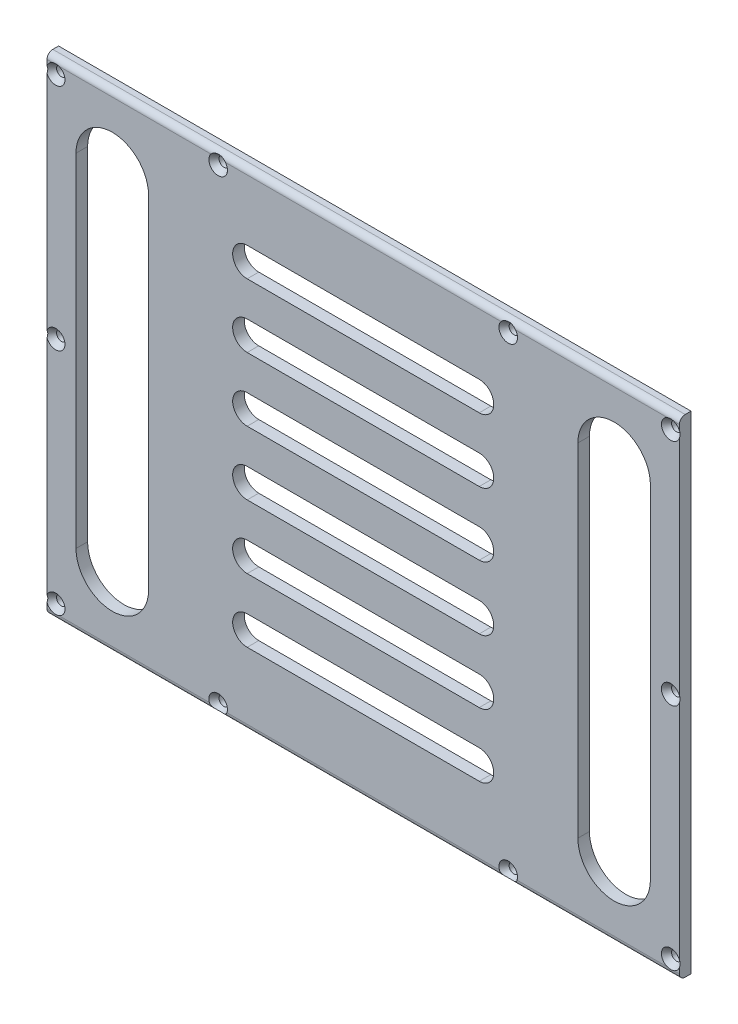
from build123d import *

# Parameters (mm, degrees)
SKETCH1_W           = 168
SKETCH1_H           = 218
SKETCH1_R           = 1.7
BOSS_EXTRUDE2_DEPTH = 4
CHAMFER1_SIZE       = 2
CHAMFER1_SIZE_2     = 1.5
FILLET1_R           = 2


with BuildPart() as part:
    # Sketch1 → Boss-Extrude2 (new body)
    with BuildSketch(Plane(origin=(0, 0, 0), x_dir=(0, 1, 0), z_dir=(0, 0, 1))):
        with Locations((84, 109)):
            Rectangle(SKETCH1_W, SKETCH1_H)
        with Locations(Location((5, 3, 0), (0, 0, 270))):
            Circle(SKETCH1_R, mode=Mode.SUBTRACT)
        with Locations(Location((5, 215, 0), (0, 0, 270))):
            Circle(SKETCH1_R, mode=Mode.SUBTRACT)
        with Locations(Location((163, 215, 0), (0, 0, 270))):
            Circle(SKETCH1_R, mode=Mode.SUBTRACT)
        with Locations(Location((163, 3, 0), (0, 0, 270))):
            Circle(SKETCH1_R, mode=Mode.SUBTRACT)
        with Locations(Location((84, 215, 0), (0, 0, 270))):
            Circle(SKETCH1_R, mode=Mode.SUBTRACT)
        with Locations(Location((84, 3, 0), (0, 0, 270))):
            Circle(SKETCH1_R, mode=Mode.SUBTRACT)
        with Locations(Location((3, 59, 0), (0, 0, 270))):
            Circle(SKETCH1_R, mode=Mode.SUBTRACT)
        with Locations(Location((164, 59, 0), (0, 0, 270))):
            Circle(SKETCH1_R, mode=Mode.SUBTRACT)
        with Locations(Location((164, 159, 0), (0, 0, 270))):
            Circle(SKETCH1_R, mode=Mode.SUBTRACT)
        with Locations(Location((3, 159, 0), (0, 0, 270))):
            Circle(SKETCH1_R, mode=Mode.SUBTRACT)
        with BuildLine():
            Line((35, 149), (35, 69))
            ThreePointArc((35, 69), (30, 64), (25, 69))
            Line((25, 69), (25, 149))
            ThreePointArc((25, 149), (30, 154), (35, 149))
        make_face(mode=Mode.SUBTRACT)
        with BuildLine():
            Line((57, 149), (57, 69))
            ThreePointArc((57, 69), (52, 64), (47, 69))
            Line((47, 69), (47, 149))
            ThreePointArc((47, 149), (52, 154), (57, 149))
        make_face(mode=Mode.SUBTRACT)
        with BuildLine():
            Line((79, 149), (79, 69))
            ThreePointArc((79, 69), (74, 64), (69, 69))
            Line((69, 69), (69, 149))
            ThreePointArc((69, 149), (74, 154), (79, 149))
        make_face(mode=Mode.SUBTRACT)
        with BuildLine():
            Line((101, 149), (101, 69))
            ThreePointArc((101, 69), (96, 64), (91, 69))
            Line((91, 69), (91, 149))
            ThreePointArc((91, 149), (96, 154), (101, 149))
        make_face(mode=Mode.SUBTRACT)
        with BuildLine():
            Line((123, 149), (123, 69))
            ThreePointArc((123, 69), (118, 64), (113, 69))
            Line((113, 69), (113, 149))
            ThreePointArc((113, 149), (118, 154), (123, 149))
        make_face(mode=Mode.SUBTRACT)
        with BuildLine():
            Line((145, 149), (145, 69))
            ThreePointArc((145, 69), (140, 64), (135, 69))
            Line((135, 69), (135, 149))
            ThreePointArc((135, 149), (140, 154), (145, 149))
        make_face(mode=Mode.SUBTRACT)
        with BuildLine():
            Line((25, 208), (143, 208))
            ThreePointArc((143, 208), (155.5, 195.5), (143, 183))
            Line((143, 183), (25, 183))
            ThreePointArc((25, 183), (12.5, 195.5), (25, 208))
        make_face(mode=Mode.SUBTRACT)
        with BuildLine():
            Line((25, 35), (143, 35))
            ThreePointArc((143, 35), (155.5, 22.5), (143, 10))
            Line((143, 10), (25, 10))
            ThreePointArc((25, 10), (12.5, 22.5), (25, 35))
        make_face(mode=Mode.SUBTRACT)
    extrude(amount=BOSS_EXTRUDE2_DEPTH)

    # Chamfer1
    # the kernel refuses this chamfer: 2, 1.5 mm, written as the material it takes off along each edge
    with BuildSketch(Plane(origin=(-3, 5, 4), x_dir=(1, 0, 0), z_dir=(0, -1, 0))) as chamfer1_piece_1:
        Polygon((1.7, -CHAMFER1_SIZE), (1.7 + CHAMFER1_SIZE_2, 0), (1.7, 0), align=None)
    revolve(axis=Axis((-3, 5, 4), (0, 0, 1)), mode=Mode.SUBTRACT)
    with BuildSketch(Plane(origin=(-59, 3, 4), x_dir=(1, 0, 0), z_dir=(0, -1, 0))) as chamfer1_piece_2:
        Polygon((1.7, -CHAMFER1_SIZE), (1.7 + CHAMFER1_SIZE_2, 0), (1.7, 0), align=None)
    revolve(axis=Axis((-59, 3, 4), (0, 0, 1)), mode=Mode.SUBTRACT)
    with BuildSketch(Plane(origin=(-59, 164, 4), x_dir=(1, 0, 0), z_dir=(0, -1, 0))) as chamfer1_piece_3:
        Polygon((1.7, -CHAMFER1_SIZE), (1.7 + CHAMFER1_SIZE_2, 0), (1.7, 0), align=None)
    revolve(axis=Axis((-59, 164, 4), (0, 0, 1)), mode=Mode.SUBTRACT)
    with BuildSketch(Plane(origin=(-159, 164, 4), x_dir=(1, 0, 0), z_dir=(0, -1, 0))) as chamfer1_piece_4:
        Polygon((1.7, -CHAMFER1_SIZE), (1.7 + CHAMFER1_SIZE_2, 0), (1.7, 0), align=None)
    revolve(axis=Axis((-159, 164, 4), (0, 0, 1)), mode=Mode.SUBTRACT)
    with BuildSketch(Plane(origin=(-159, 3, 4), x_dir=(1, 0, 0), z_dir=(0, -1, 0))) as chamfer1_piece_5:
        Polygon((1.7, -CHAMFER1_SIZE), (1.7 + CHAMFER1_SIZE_2, 0), (1.7, 0), align=None)
    revolve(axis=Axis((-159, 3, 4), (0, 0, 1)), mode=Mode.SUBTRACT)
    with BuildSketch(Plane(origin=(-215, 5, 4), x_dir=(1, 0, 0), z_dir=(0, -1, 0))) as chamfer1_piece_6:
        Polygon((1.7, -CHAMFER1_SIZE), (1.7 + CHAMFER1_SIZE_2, 0), (1.7, 0), align=None)
    revolve(axis=Axis((-215, 5, 4), (0, 0, 1)), mode=Mode.SUBTRACT)
    with BuildSketch(Plane(origin=(-215, 163, 4), x_dir=(1, 0, 0), z_dir=(0, -1, 0))) as chamfer1_piece_7:
        Polygon((1.7, -CHAMFER1_SIZE), (1.7 + CHAMFER1_SIZE_2, 0), (1.7, 0), align=None)
    revolve(axis=Axis((-215, 163, 4), (0, 0, 1)), mode=Mode.SUBTRACT)
    with BuildSketch(Plane(origin=(-3, 163, 4), x_dir=(1, 0, 0), z_dir=(0, -1, 0))) as chamfer1_piece_8:
        Polygon((1.7, -CHAMFER1_SIZE), (1.7 + CHAMFER1_SIZE_2, 0), (1.7, 0), align=None)
    revolve(axis=Axis((-3, 163, 4), (0, 0, 1)), mode=Mode.SUBTRACT)
    with BuildSketch(Plane(origin=(-215, 84, 4), x_dir=(1, 0, 0), z_dir=(0, -1, 0))) as chamfer1_piece_9:
        Polygon((1.7, -CHAMFER1_SIZE), (1.7 + CHAMFER1_SIZE_2, 0), (1.7, 0), align=None)
    revolve(axis=Axis((-215, 84, 4), (0, 0, 1)), mode=Mode.SUBTRACT)
    with BuildSketch(Plane(origin=(-3, 84, 4), x_dir=(1, 0, 0), z_dir=(0, -1, 0))) as chamfer1_piece_10:
        Polygon((1.7, -CHAMFER1_SIZE), (1.7 + CHAMFER1_SIZE_2, 0), (1.7, 0), align=None)
    revolve(axis=Axis((-3, 84, 4), (0, 0, 1)), mode=Mode.SUBTRACT)

    # Fillet1
    # the kernel refuses this fillet: 2 mm, written as the material it takes off along each edge
    with BuildSketch(Plane(origin=(5, 168, 4), x_dir=(0, 0, -1), z_dir=(-1, 0, 0))) as fillet1_piece_1:
        with BuildLine():
            CenterArc((FILLET1_R, FILLET1_R), FILLET1_R, 180, 90)
            Line((0, FILLET1_R), (0, 0))
            Line((0, 0), (FILLET1_R, 0))
        make_face()
    extrude(amount=228, mode=Mode.SUBTRACT)
    with BuildSketch(Plane(origin=(-162.886447127, 0, 4), x_dir=(0, 1, 0), z_dir=(1, 0, 0))) as fillet1_piece_2:
        with BuildLine():
            CenterArc((FILLET1_R, -FILLET1_R), FILLET1_R, 90, 90)
            Line((0, -FILLET1_R), (0, 0))
            Line((0, 0), (FILLET1_R, 0))
        make_face()
    extrude(amount=107.772894255, mode=Mode.SUBTRACT)
    with BuildSketch(Plane(origin=(-62.886447127, 0, 4), x_dir=(0, 1, 0), z_dir=(1, 0, 0)), Plane(origin=(-223, 0, 4), x_dir=(0, 1, 0), z_dir=(1, 0, 0))) as fillet1_piece_3:
        with BuildLine():
            CenterArc((FILLET1_R, -FILLET1_R), FILLET1_R, 90, 90)
            Line((0, -FILLET1_R), (0, 0))
            Line((0, 0), (FILLET1_R, 0))
        make_face()
    extrude(amount=67.886447127, mode=Mode.SUBTRACT)


solid = part.part
